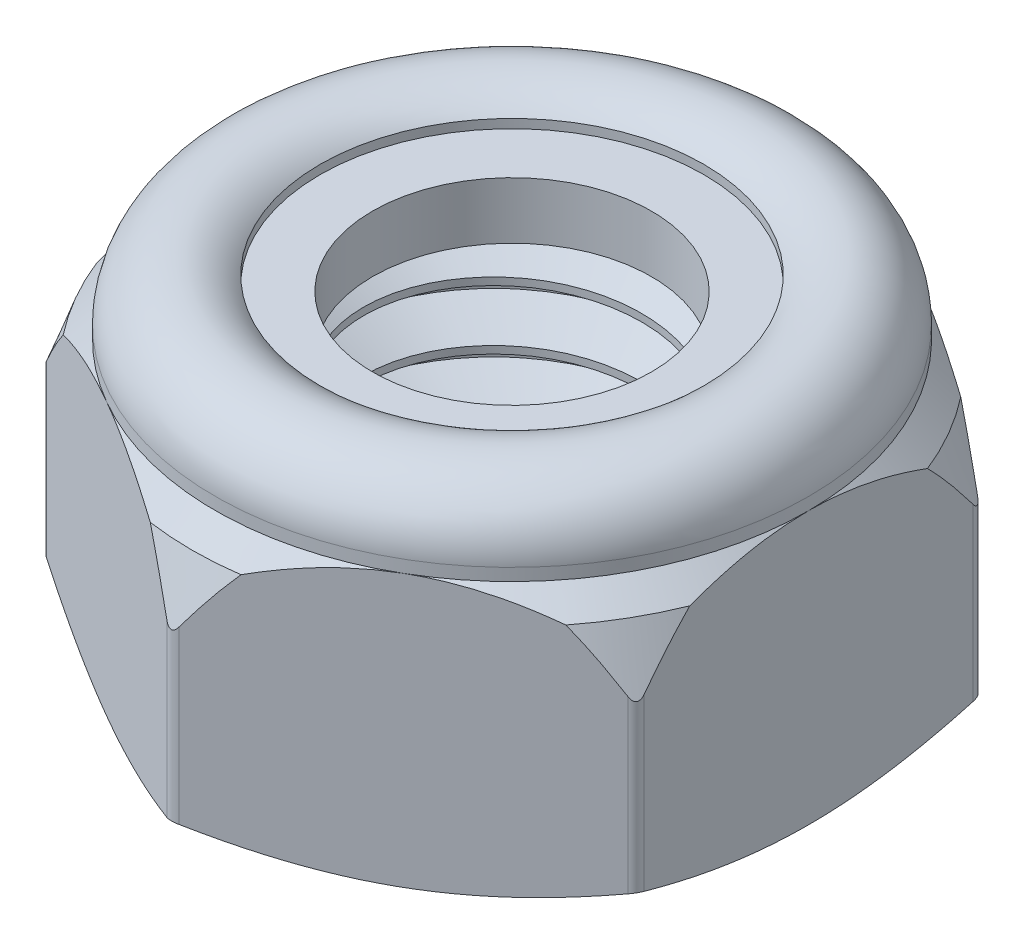
from build123d import *

# Parameters (mm, degrees)
BOSS_EXTRUDE1_DEPTH      = 3
BOSS_EXTRUDE1_DEPTH_BACK = 3
SKETCH2_R                = 2.350480947
FILLET1_R                = 0.2
SKETCH4_W                = 1.614817501
SKETCH4_H                = 0.956942932
SKETCH6_W                = 3
SKETCH6_H                = 4.758358138
CUT_SWEEP1_PITCH         = 1
SKETCH10_R               = 2.950480947
BOSS_EXTRUDE2_DEPTH      = 4.5


with BuildPart() as part:
    # Sketch2 → Boss-Extrude1 (new, two sides: drawn at the far end of the back side and taken through both)
    with BuildSketch(Plane(origin=(0, 0, 0), x_dir=(1, 0, 0), z_dir=(0, 1, 0)).offset(-BOSS_EXTRUDE1_DEPTH_BACK)):
        Polygon((0, 5.773502692), (-5, 2.886751346), (-5, -2.886751346), (0, -5.773502692), (5, -2.886751346), (5, 2.886751346), align=None)
        with Locations(Location((0, 0, 0), (0, 0, 270))):
            Circle(SKETCH2_R, mode=Mode.SUBTRACT)
    extrude(amount=BOSS_EXTRUDE1_DEPTH + BOSS_EXTRUDE1_DEPTH_BACK)

    # Sketch3 → Cut-Revolve2 (revolve, cut)
    with BuildSketch(Plane(origin=(0, 0, 0), x_dir=(0, 0, -1), z_dir=(1, 0, 0)), mode=Mode.PRIVATE) as cut_revolve2_sk:
        with BuildLine():
            Line((5.773502692, 1.758358138), (5.773502692, 4.241641862))
            Line((5.773502692, 4.241641862), (2.350480947, 4.241641862))
            Line((2.350480947, 4.241641862), (2.350480947, 1.5))
            Line((2.350480947, 1.5), (3.233653965, 1.5))
            Line((3.233653965, 1.5), (3.965298448, 1.5))
            Line((3.965298448, 1.5), (3.965298448, 2.546942932))
            Line((3.965298448, 2.546942932), (3.233653965, 2.546942932))
            Line((3.233653965, 2.546942932), (3.233653965, 2.696942932))
            ThreePointArc((3.233653965, 2.696942932), (4.36126159, 2.921238034), (5, 1.965298448))
            Line((5, 1.965298448), (5, 1.758358138))
            Line((5, 1.758358138), (5.773502692, 0.984855446))
            Line((5.773502692, 0.984855446), (5.773502692, 1.758358138))
        make_face()
        Polygon((4.7, -3), (5.773502692, -2.380212932), (5.773502692, -3), align=None)
        Polygon((2.350480947, -3), (2.350480947, -2.4), (2.950480947, -3), align=None)
    revolve(cut_revolve2_sk.sketch.rotate(Axis((0, -3, 0), (0, 1, 0)), 270), axis=Axis((0, -3, 0), (0, 1, 0)), mode=Mode.SUBTRACT)

    # Sketch11 → Cut-Revolve3 (revolve, cut)
    with BuildSketch(Plane(origin=(0, 0, 0), x_dir=(0, 0, -1), z_dir=(1, 0, 0)), mode=Mode.PRIVATE) as cut_revolve3_sk:
        Polygon((5.773502692, 0.309016202), (5.773502692, 1.371606792), (5.386751346, 1.371606792), align=None)
    revolve(cut_revolve3_sk.sketch.rotate(Axis((0, -3, 0), (0, 1, 0)), 270), axis=Axis((0, -3, 0), (0, 1, 0)), mode=Mode.SUBTRACT)

    # Fillet1
    fillet1_edges = [part.edges().sort_by_distance(p)[0] for p in [
        (-5, -1.035598365, -2.886751346),
        (0, -1.035598365, -5.773502692),
        (-5, -1.035598365, 2.886751346),
        (5, -1.035598365, -2.886751346),
        (5, -1.035598365, 2.886751346),
        (0, -1.035598365, 5.773502692),
    ]]
    fillet(fillet1_edges, radius=FILLET1_R)

    # Sketch10 → Boss-Extrude2 (add)
    with BuildSketch(Plane.XZ.offset(3)):
        Circle(SKETCH10_R)
    extrude(amount=-BOSS_EXTRUDE2_DEPTH)


with BuildPart() as body_2:
    # Sketch4 → Revolve1 (revolve)
    with BuildSketch(Plane(origin=(0, 0, 0), x_dir=(0, 0, -1), z_dir=(1, 0, 0)), mode=Mode.PRIVATE) as revolve1_sk:
        with Locations((3.157889698, 1.978471466)):
            Rectangle(SKETCH4_W, SKETCH4_H)
    revolve(revolve1_sk.sketch.rotate(Axis((0, -3, 0), (0, 1, 0)), 270), axis=Axis((0, -3, 0), (0, 1, 0)))


with BuildPart() as body_3:
    # Sketch6 → Revolve2 (revolve)
    with BuildSketch(Plane.XY, mode=Mode.PRIVATE) as revolve2_sk:
        with Locations((1.5, -0.620820931)):
            Rectangle(SKETCH6_W, SKETCH6_H)
    revolve(revolve2_sk.sketch.rotate(Axis((0, -3, 0), (0, 1, 0)), 90), axis=Axis((0, -3, 0), (0, 1, 0)))

    # Cut-Sweep1: the profile of Sketch8 profile screwed along a right-hand helix of 6 turns, 8 arcs to a turn; built about Z, then put on its axis
    cut_sweep1_z = Axis((0, 0, 0), (0, 0, 1))
    cut_sweep1_corners = [(2.350180947, 0, -0.375173205), (2.350180947, 0, -0.499826795), (3.054126588, 0, -0.90625), (3.108253175, 0, 0.0625)]
    with BuildLine(mode=Mode.PRIVATE) as cut_sweep1_profile:
        Line(cut_sweep1_corners[0], cut_sweep1_corners[1])
        Line(cut_sweep1_corners[1], cut_sweep1_corners[2])
        Line(cut_sweep1_corners[2], cut_sweep1_corners[3])
        Line(cut_sweep1_corners[3], cut_sweep1_corners[0])
    cut_sweep1_cap = Face(cut_sweep1_profile.wire())
    cut_sweep1_turn_angles = [0, 22.5, 45, 67.5, 90, 112.5, 135, 157.5, 180, 202.5, 225, 247.5, 270, 292.5, 315, 337.5, 360]
    cut_sweep1_turn_weights = [1, 0.9238795325112867, 1, 0.9238795325112867, 1, 0.9238795325112867, 1, 0.9238795325112867, 1, 0.9238795325112867, 1, 0.9238795325112867, 1, 0.9238795325112867, 1, 0.9238795325112867, 1]
    cut_sweep1_turn_rails = [Edge.make_bspline([Vector(p[0], p[1], 0).rotate(cut_sweep1_z, cut_sweep1_turn_angles[k]) / cut_sweep1_turn_weights[k] + Vector(0, 0, p[2] + CUT_SWEEP1_PITCH * cut_sweep1_turn_angles[k] / 360) for k in range(17)], [0, 0, 0, 1, 1, 2, 2, 3, 3, 4, 4, 5, 5, 6, 6, 7, 7, 8, 8, 8], 2, cut_sweep1_turn_weights) for p in cut_sweep1_corners]
    cut_sweep1_turn_sides = [Face.make_surface_from_curves(cut_sweep1_turn_rails[p[0]], cut_sweep1_turn_rails[p[1]]) for p in [(0, 1), (1, 2), (2, 3), (3, 0)]]
    cut_sweep1 = Plane(origin=(0, -3, 0), x_dir=(1, 0, 0), z_dir=(0, 1, 0)) * Solid(Shell([*[p.moved(Location((0, 0, CUT_SWEEP1_PITCH * i))) for i in range(6) for p in cut_sweep1_turn_sides], cut_sweep1_cap, cut_sweep1_cap.rotate(cut_sweep1_z, 2160).moved(Location((0, 0, CUT_SWEEP1_PITCH * 2160 / 360)))]))
    add(cut_sweep1, mode=Mode.SUBTRACT)

    # Sketch9 → Revolve3 (revolve)
    with BuildSketch(Plane.XY, mode=Mode.PRIVATE) as revolve3_sk:
        Polygon((0, 0), (0, -3), (3, -3), (3.6, -3), (0, 0.6), align=None)
    revolve(revolve3_sk.sketch.rotate(Axis((0, 0, 0), (0, -1, 0)), 90.182506618), axis=Axis((0, 0, 0), (0, -1, 0)))


with BuildPart() as part_1:
    add(part.part)

    # Combine1: cut body 3
    add(body_3.part, mode=Mode.SUBTRACT)


solid = Compound([body_2.part, part_1.part])
